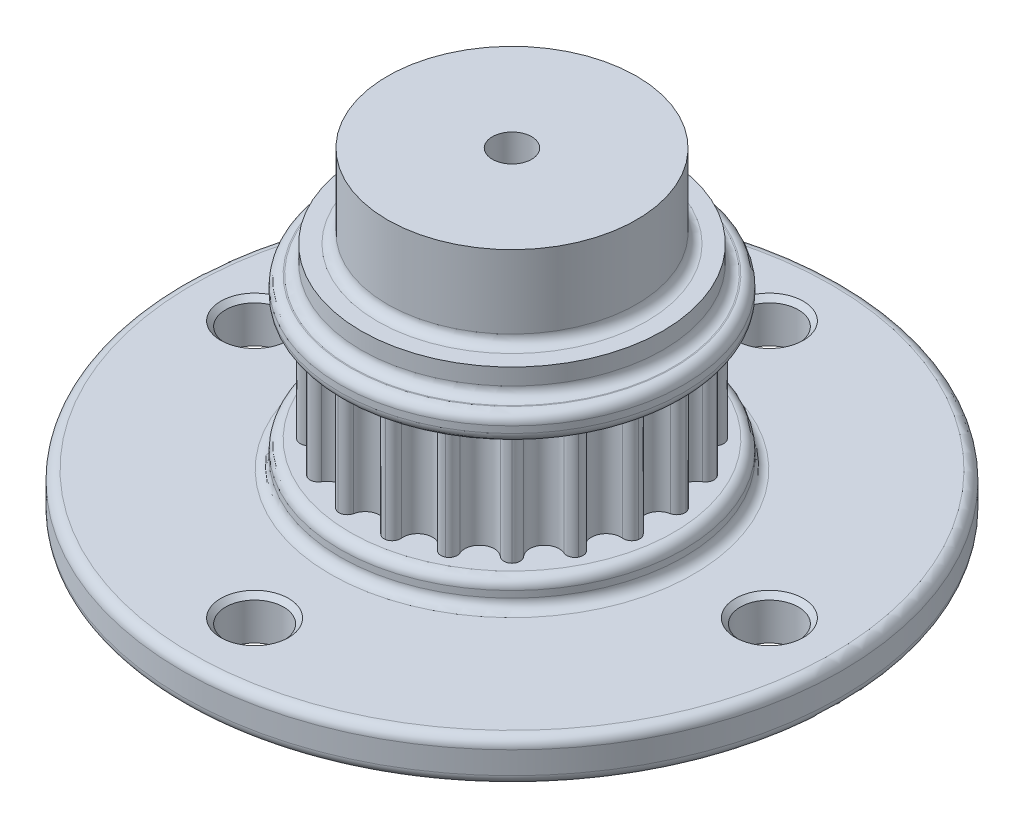
from build123d import *

# Parameters (mm, degrees)
BOSS_EXTRUDE1_DEPTH     = 3.556
CIRPATTERN1_COUNT       = 20
SKETCH9_R               = 19.84375
SKETCH9_R_2             = 1.4999999999999996
BOSS_EXTRUDE2_DEPTH     = 2.54
CUT_EXTRUDE1_DEPTH      = 30.081395842465593
CUT_EXTRUDE1_DEPTH_BACK = 30.081395842465593
SKETCH3_R               = 1.7462499999999996
SKETCH3_R_2             = 1.746249999999999
SKETCH3_R_3             = 1.7462500000000012
SKETCH3_R_4             = 1.7462499999999985
CIRPATTERN2_COUNT       = 4
CUT_EXTRUDE2_START      = -6
SKETCH11_R              = 1.5
CUT_EXTRUDE2_DEPTH      = 6
FILLET1_R               = 0.5953125


with BuildPart() as part:
    # Sketch1 → Boss-Extrude1 (new, symmetric)
    with BuildSketch(Plane(origin=(0, 0, 0), x_dir=(1, 0, 0), z_dir=(0, 1, 0))):
        with BuildLine():
            ThreePointArc((0.8720606070123648, 8.659786465382457), (0.5629673031092283, 8.148255135369217), (0, 7.947579307894175))
            ThreePointArc((0, 7.947579307894175), (-1.2432753173952258, -7.8497314183622535), (2.4559370702819923, 7.558597089545281))
            ThreePointArc((2.4559370702819887, 7.558597089545281), (1.982535589248892, 7.923417606866525), (1.8466422625579257, 8.505427895318311))
            ThreePointArc((1.846642262557925, 8.505427895318311), (1.749626992044169, 8.862101959434877), (1.4341191216417435, 9.054671776489402))
            ThreePointArc((1.4341191216417435, 9.054671776489402), (1.0745459594794837, 8.96902429095141), (0.8720606070123653, 8.659786465382457))
        make_face()
    boss_extrude1 = extrude(amount=BOSS_EXTRUDE1_DEPTH, both=True)

    # CirPattern1: Boss-Extrude1 ×20 about axis
    cirpattern1_axis = Axis((0, 3.3, 0), (0, -1, 0))
    for i in range(1, CIRPATTERN1_COUNT):
        add(boss_extrude1.rotate(cirpattern1_axis, i * 360 / CIRPATTERN1_COUNT))

    # Sketch2 → Revolve3 (revolve)
    with BuildSketch(Plane(origin=(0, 0, 0), x_dir=(0, 0, -1), z_dir=(1, 0, 0))):
        Polygon((10.342329407894177, 5.087499985000001), (0, 5.087499985), (2e-16, 3.4999999849999996), (10.342329407894177, 3.499999985000001), align=None)
    revolve3 = revolve(axis=Axis((0, 3.3, 0), (0, -1, 0)))

    # Mirror1: Revolve3 across plane
    add(revolve3.mirror(Plane.ZX))

    # Sketch9 → Boss-Extrude2 (add)
    with BuildSketch(Plane.XZ.offset(5.087499985000001)):
        Circle(SKETCH9_R)
        Circle(SKETCH9_R_2, mode=Mode.SUBTRACT)
    extrude(amount=BOSS_EXTRUDE2_DEPTH)

    # Sketch3 → Cut-Extrude1 (cut, two sides: drawn at the far end of the back side and taken through both)
    with BuildSketch(Plane(origin=(0, 0, 0), x_dir=(1, 0, 0), z_dir=(0, 1, 0)).offset(-CUT_EXTRUDE1_DEPTH_BACK)):
        with Locations((-15.5, 0)):
            Circle(SKETCH3_R)
        with Locations((0, 15.500000000000002)):
            Circle(SKETCH3_R_2)
        with Locations((15.500000000000002, 0)):
            Circle(SKETCH3_R_3)
        with Locations((3.47e-15, -15.500000000000002)):
            Circle(SKETCH3_R_4)
    extrude(amount=CUT_EXTRUDE1_DEPTH + CUT_EXTRUDE1_DEPTH_BACK, mode=Mode.SUBTRACT)

    # Sketch6 → Cut-Revolve2 (revolve, cut)
    with BuildSketch(Plane.XY):
        Polygon((-11.8678, -3.499999985), (-15.5, -7.132199984999997), (-15.5, -3.499999985), align=None)
    cut_revolve2 = revolve(axis=Axis((-15.5, -7.627499985000001, 0), (0, 1, 0)), mode=Mode.SUBTRACT)

    # CirPattern2: Cut-Revolve2 ×4 about axis
    cirpattern2_axis = Axis((0, 3.3, 0), (0, -1, 0))
    for i in range(1, CIRPATTERN2_COUNT):
        add(cut_revolve2.rotate(cirpattern2_axis, i * 360 / CIRPATTERN2_COUNT), mode=Mode.SUBTRACT)

    # Sketch11 → Cut-Extrude2 (cut)
    with BuildSketch(Plane.XZ.offset(5.087499985000001).offset(CUT_EXTRUDE2_START)):
        Circle(SKETCH11_R)
    extrude(amount=CUT_EXTRUDE2_DEPTH, mode=Mode.SUBTRACT)

    # Sketch10 → Revolve4 (revolve)
    with BuildSketch(Plane(origin=(0, 0, 0), x_dir=(0, 0, -1), z_dir=(1, 0, 0))):
        Polygon((1.1821750652977259, 6.674999985000001), (1.1821750652977259, 11.674999985), (7.499999999999998, 11.674999985), (7.499999999999999, 6.674999985000001), (9.087499999999999, 6.674999985000001), (9.087500000000002, 5.087499985000001), (1.182175065297726, 5.087499985000001), align=None)
    revolve(axis=Axis((0, 0, 0), (0, 1, 0)))

    # Fillet1
    fillet1_edges = [part.edges().sort_by_distance(p)[0] for p in [
        (1.27e-15, 5.087499985000001, 10.342329407894177),
        (1.27e-15, 3.499999985000001, 10.342329407894177),
        (-19.84375, -7.627499985000001, 2.43e-15),
        (-19.84375, -5.087499985000001, 2.43e-15),
        (-9.2e-16, 6.674999985000001, 7.499999999999999),
        (-1.11e-15, 5.087499985000001, 9.087500000000002),
        (1.27e-15, -3.499999985000001, 10.342329407894177),
        (1.27e-15, -5.087499985000001, 10.342329407894177),
    ]]
    fillet(fillet1_edges, radius=FILLET1_R)


solid = part.part
